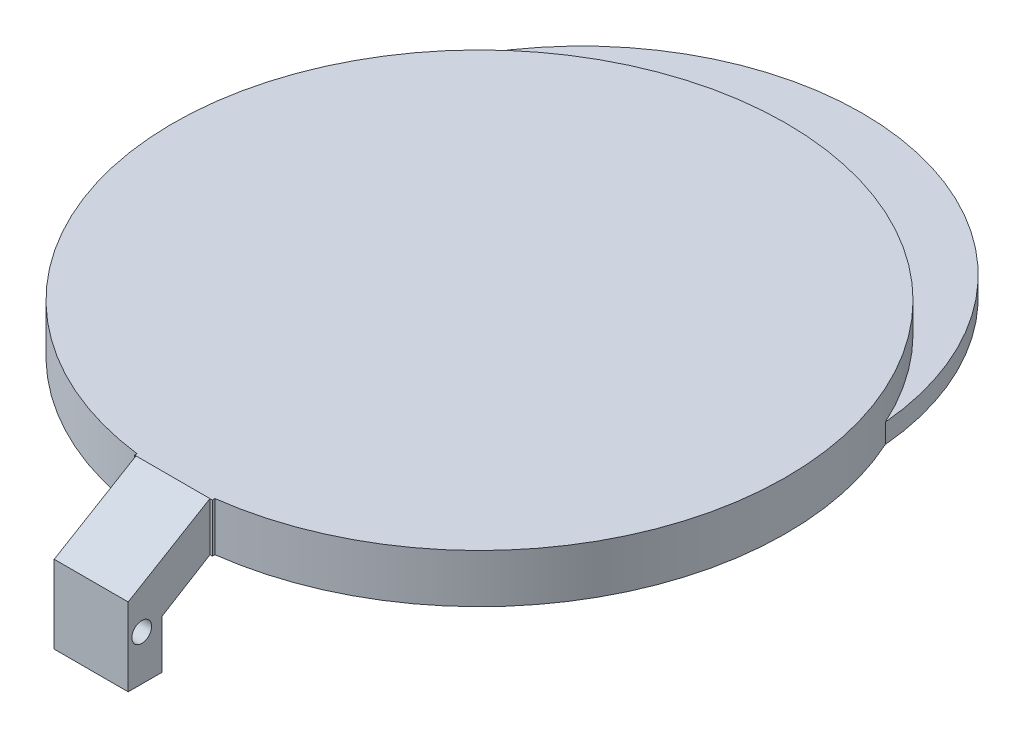
from build123d import *

# Parameters (mm, degrees)
SKETCH1_R           = 40.005
BOSS_EXTRUDE1_DEPTH = 6.35
BOSS_EXTRUDE2_DEPTH = 2.54
SHELL2_OUTLINE_R    = 37.719
SHELL2_DEPTH        = 4.064
SHELL2_2_DEPTH      = 0.254
BOSS_EXTRUDE3_DEPTH = 4.826
CUT_EXTRUDE1_REACH  = 70.416
SKETCH10_R          = 1.293229199


# Read off the part's stored shape, not the designer's step: Shell2
with BuildPart() as part:
    # Sketch1 → Boss-Extrude1 (new body)
    with BuildSketch(Plane(origin=(0, 0, 0), x_dir=(1, 0, 0), z_dir=(0, 1, 0))):
        with Locations(Location((0, 0, 0), (0, 0, 270))):
            Circle(SKETCH1_R)
    extrude(amount=BOSS_EXTRUDE1_DEPTH)

    # Sketch2 → Boss-Extrude2 (add)
    with BuildSketch(Plane(origin=(0, 0, 0), x_dir=(1, 0, 0), z_dir=(0, 1, 0))):
        with BuildLine():
            ThreePointArc((-36.439263508, 16.51), (0, 49.926276753), (36.439263508, 16.51))
            ThreePointArc((36.439263508, 16.51), (0, -40.005), (-36.439263508, 16.51))
        make_face()
    extrude(amount=BOSS_EXTRUDE2_DEPTH)

    # Shell2 outline → Shell2 (cut)
    with BuildSketch(Plane(origin=(0, 0, 0), x_dir=(1, 0, 0), z_dir=(0, 1, 0))):
        Circle(SHELL2_OUTLINE_R)
    extrude(amount=SHELL2_DEPTH, mode=Mode.SUBTRACT)

    # Shell2 2 outline → Shell2 2 (cut)
    with BuildSketch(Plane(origin=(0, 0, 0), x_dir=(1, 0, 0), z_dir=(0, 1, 0))):
        with BuildLine():
            ThreePointArc((-34.19336189, 15.922844082), (0, 37.719), (34.19336189, 15.922844082))
            ThreePointArc((34.19336189, 15.922844082), (0, 47.640276753), (-34.19336189, 15.922844082))
        make_face()
    extrude(amount=SHELL2_2_DEPTH, mode=Mode.SUBTRACT)



with BuildPart() as body_2:
    # Sketch6 → Boss-Extrude3 (new, symmetric)
    with BuildSketch(Plane(origin=(0, 0, 0), x_dir=(0, 0, -1), z_dir=(1, 0, 0))):
        Polygon((-40.005, 6.35), (-50.673, 0), (-50.673, -10.16), (-46.228, -10.16), (-46.228, -3.81), (-40.005, 0), align=None)
    extrude(amount=BOSS_EXTRUDE3_DEPTH, both=True)


with BuildPart() as part_1:
    add(part.part)

    add(body_2.part)  # Loft1 merges body 2
    # Sketch9 → Loft1 section 0
    with BuildSketch(Plane.XY.offset(38.1)):
        with BuildLine():
            Line((-5.008565366, 6.35), (5.151434634, 6.35))
            Line((5.151434634, 6.35), (5.151434634, 0))
            Line((5.151434634, 0), (-5.008565366, 0))
            Line((-5.008565366, 0), (-5.008565366, 6.35))
        make_face()
    # Sketch7 → Loft1 section 1
    with BuildSketch(Plane(origin=(0, 0, 40.005), x_dir=(-1, 0, 0), z_dir=(0, 0, -1))):
        with BuildLine():
            Line((-5.151434634, 0), (5.008565366, 0))
            Line((5.008565366, 0), (5.008565366, 6.35))
            Line((5.008565366, 6.35), (-5.151434634, 6.35))
            Line((-5.151434634, 6.35), (-5.151434634, 0))
        make_face()
    loft()

    # Sketch10 → Cut-Extrude1 (cut, up to next)
    with BuildSketch(Plane.ZY.offset(4.826), mode=Mode.PRIVATE) as cut_extrude1_sk1:
        with Locations((48.902107894, -4.275925595)):
            Circle(SKETCH10_R)
    cut_extrude1_tool1 = extrude(cut_extrude1_sk1.sketch, amount=-CUT_EXTRUDE1_REACH, mode=Mode.PRIVATE) & part_1.part
    add(cut_extrude1_tool1.solids().sort_by_distance((-4.826, -4.275926, 48.902108))[0], mode=Mode.SUBTRACT)


solid = part_1.part
